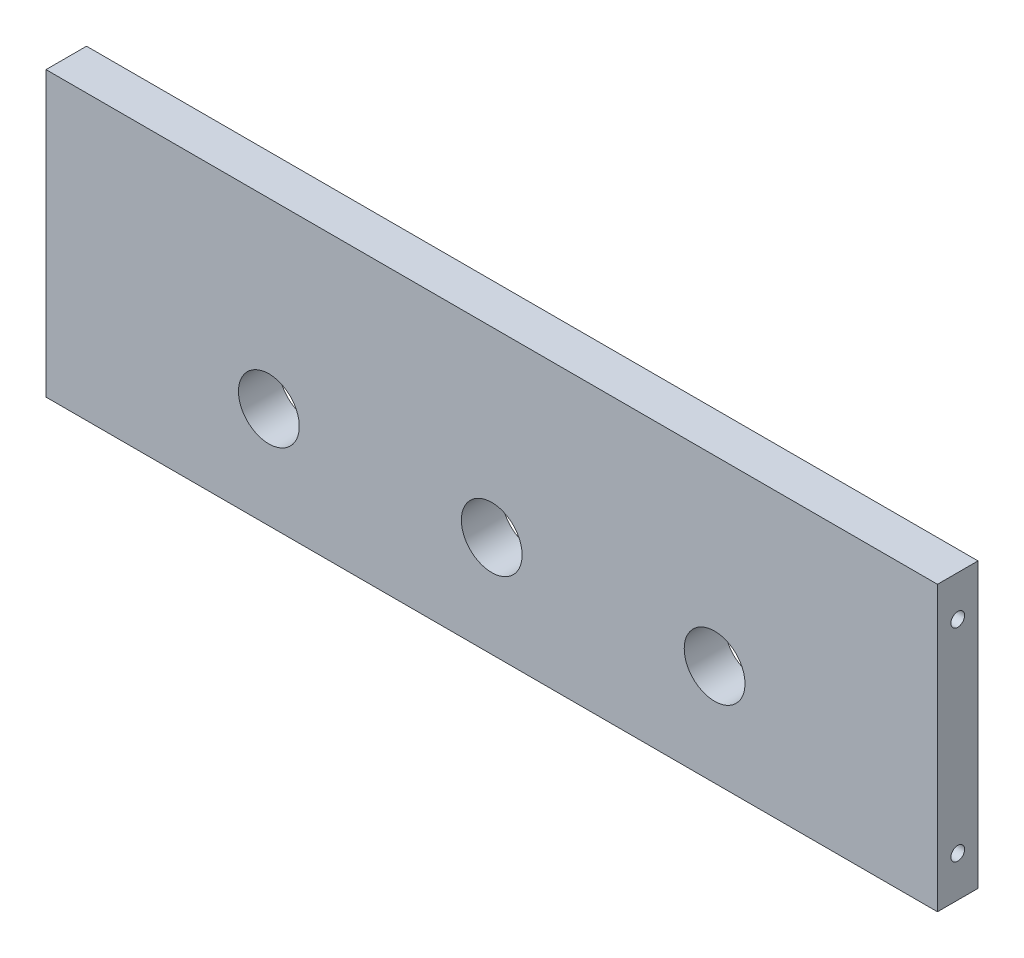
from build123d import *

# Parameters (mm, degrees)
SKETCH1_W           = 279.4
SKETCH1_H           = 88.9
BOSS_EXTRUDE1_DEPTH = 12.7
SKETCH2_R           = 2.1463
CUT_EXTRUDE1_DEPTH  = 38.1
CUT_EXTRUDE2_START  = -38.1
SKETCH3_R           = 2.1463
CUT_EXTRUDE2_DEPTH  = 38.1
SKETCH4_R           = 9.525
CUT_EXTRUDE3_DEPTH  = 294.477188211


with BuildPart() as part:
    # Sketch1 → Boss-Extrude1 (new body)
    with BuildSketch(Plane.XY):
        with Locations((139.7, 44.45)):
            Rectangle(SKETCH1_W, SKETCH1_H)
    extrude(amount=BOSS_EXTRUDE1_DEPTH)

    # Sketch2 → Cut-Extrude1 (cut)
    with BuildSketch(Plane(origin=(279.4, 0, 0), x_dir=(0, 0, -1), z_dir=(1, 0, 0))):
        with Locations((-6.35, 76.2)):
            Circle(SKETCH2_R)
        with Locations((-6.35, 12.7)):
            Circle(SKETCH2_R)
    extrude(amount=-CUT_EXTRUDE1_DEPTH, mode=Mode.SUBTRACT)

    # Sketch3 → Cut-Extrude2 (cut)
    with BuildSketch(Plane.ZY.offset(CUT_EXTRUDE2_START)):
        with Locations((6.35, 76.2)):
            Circle(SKETCH3_R)
        with Locations((6.35, 12.7)):
            Circle(SKETCH3_R)
    extrude(amount=CUT_EXTRUDE2_DEPTH, mode=Mode.SUBTRACT)

    # Sketch4 → Cut-Extrude3 (cut, through all)
    with BuildSketch(Plane(origin=(0, 0, 0), x_dir=(-1, 0, 0), z_dir=(0, 0, -1))):
        with Locations((-209.55, 31.75)):
            Circle(SKETCH4_R)
        with Locations((-139.7, 31.75)):
            Circle(SKETCH4_R)
        with Locations((-69.85, 31.75)):
            Circle(SKETCH4_R)
    extrude(amount=-CUT_EXTRUDE3_DEPTH, mode=Mode.SUBTRACT)


solid = part.part
